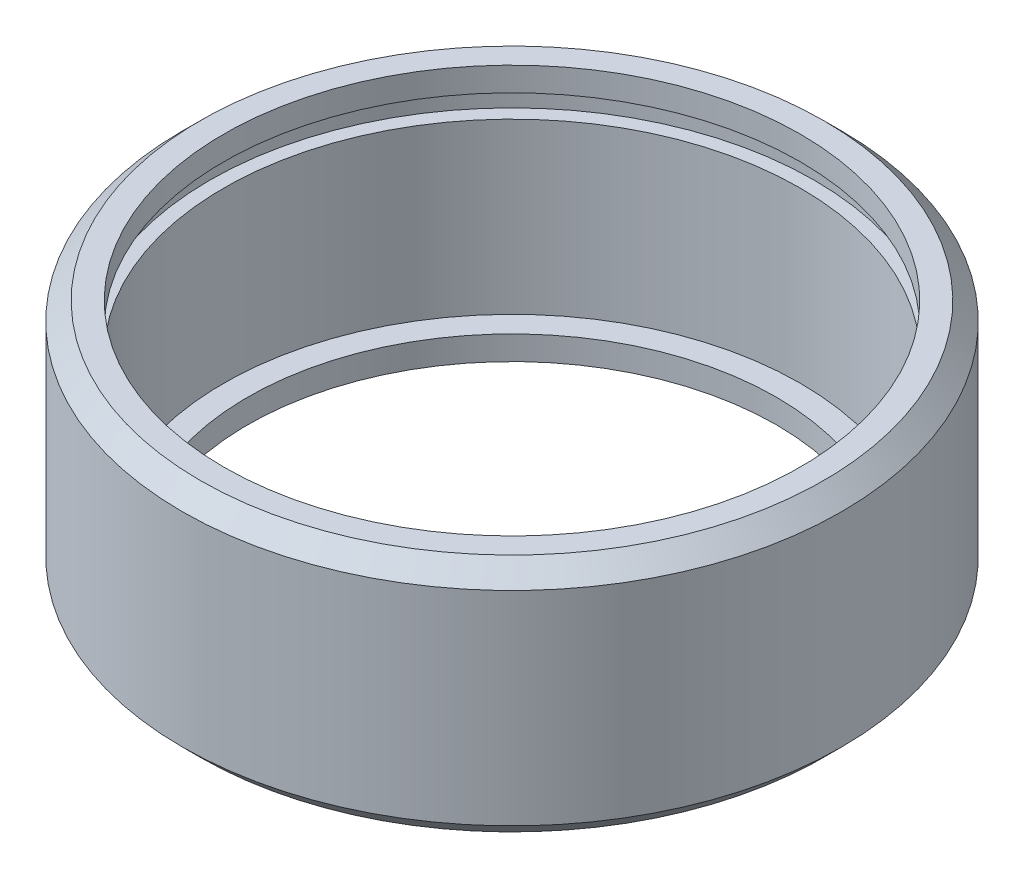
from build123d import *


with BuildPart() as part:
    # Sketch3 → Revolve1 (revolve)
    with BuildSketch(Plane.XY):
        Polygon((11.025, 0), (11.025, 1), (12.025, 1), (12.025, 8.05), (12.6, 8.05), (12.6, 9), (12.025, 9), (12.025, 10), (13, 10), (13.75, 9.25), (13.75, 0.75), (13, 0), align=None)
    revolve(axis=Axis((0, 0, 0), (0, 1, 0)))


solid = part.part
